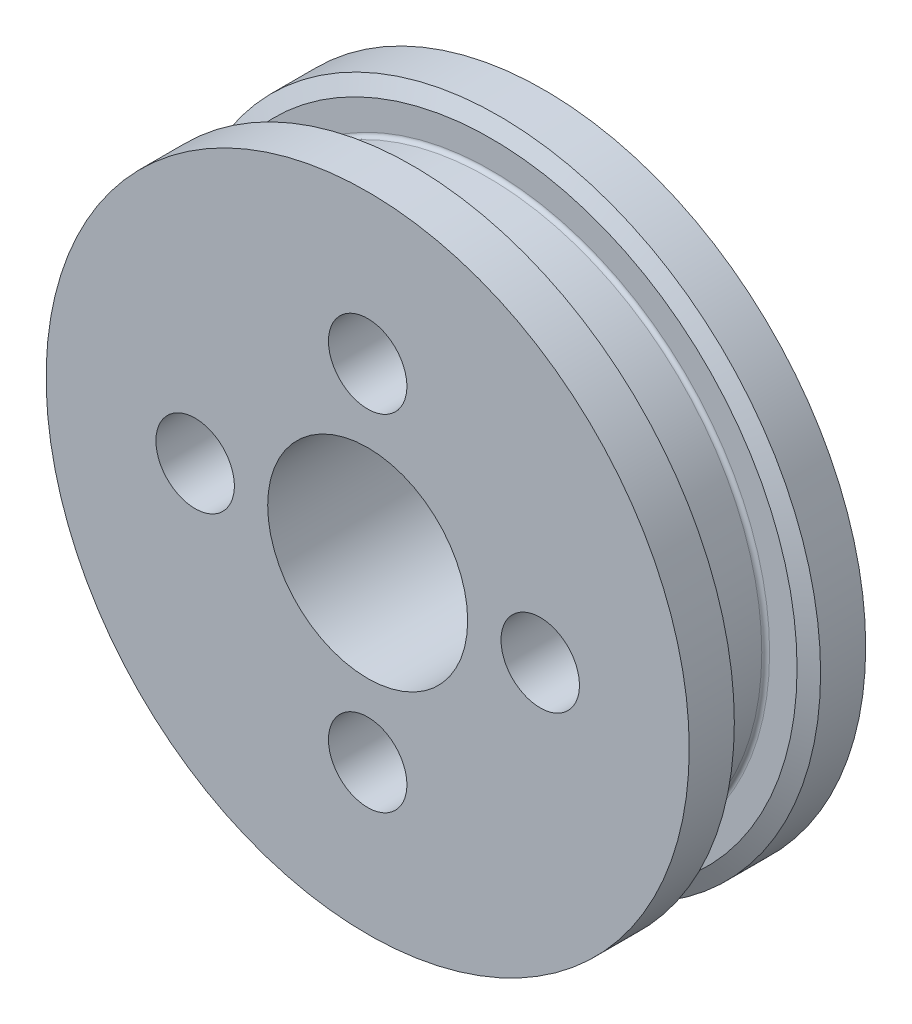
from build123d import *

# Parameters (mm, degrees)
SKETCH3_W               = 16.51
SKETCH3_H               = 16.51
SKETCH3_R               = 6.477
BOSS_EXTRUDE1_DEPTH     = 3.175
CUT_EXTRUDE1_DEPTH      = 32.595190583
CUT_EXTRUDE1_DEPTH_BACK = 32.595190583
SKETCH4_R               = 2.54
FILLET1_R               = 0.254


with BuildPart() as part:
    # Sketch2 → Revolve1 (revolve)
    with BuildSketch(Plane(origin=(0, 0, 0), x_dir=(0, 0, -1), z_dir=(1, 0, 0))):
        Polygon((0, 6.477), (0, 20.828), (2.921, 20.828), (3.429, 19.812), (3.429, 17.78), (8.001, 17.78), (8.001, 19.812), (8.509, 20.828), (11.43, 20.828), (11.43, 6.477), align=None)
    revolve(axis=Axis((0, 0, 0), (0, 0, -1)))

    # Sketch3 → Boss-Extrude1 (add)
    with BuildSketch(Plane(origin=(0, 0, -11.43), x_dir=(-1, 0, 0), z_dir=(0, 0, -1))):
        Rectangle(SKETCH3_W, SKETCH3_H)
        Circle(SKETCH3_R, mode=Mode.SUBTRACT)
    extrude(amount=BOSS_EXTRUDE1_DEPTH)

    # Sketch4 → Cut-Extrude1 (cut, two sides: drawn at the far end of the back side and taken through both)
    with BuildSketch(Plane(origin=(0, 0, -11.43), x_dir=(-1, 0, 0), z_dir=(0, 0, -1)).offset(-CUT_EXTRUDE1_DEPTH_BACK)):
        with Locations((0, 11.176)):
            Circle(SKETCH4_R)
        with Locations((11.176, 0)):
            Circle(SKETCH4_R)
        with Locations((0, -11.176)):
            Circle(SKETCH4_R)
        with Locations((-11.176, 0)):
            Circle(SKETCH4_R)
    extrude(amount=CUT_EXTRUDE1_DEPTH + CUT_EXTRUDE1_DEPTH_BACK, mode=Mode.SUBTRACT)

    # Fillet1
    fillet1_edges = [part.edges().sort_by_distance(p)[0] for p in [
        (0, -17.78, -8.001),
        (0, -17.78, -3.429),
    ]]
    fillet(fillet1_edges, radius=FILLET1_R)


solid = part.part
